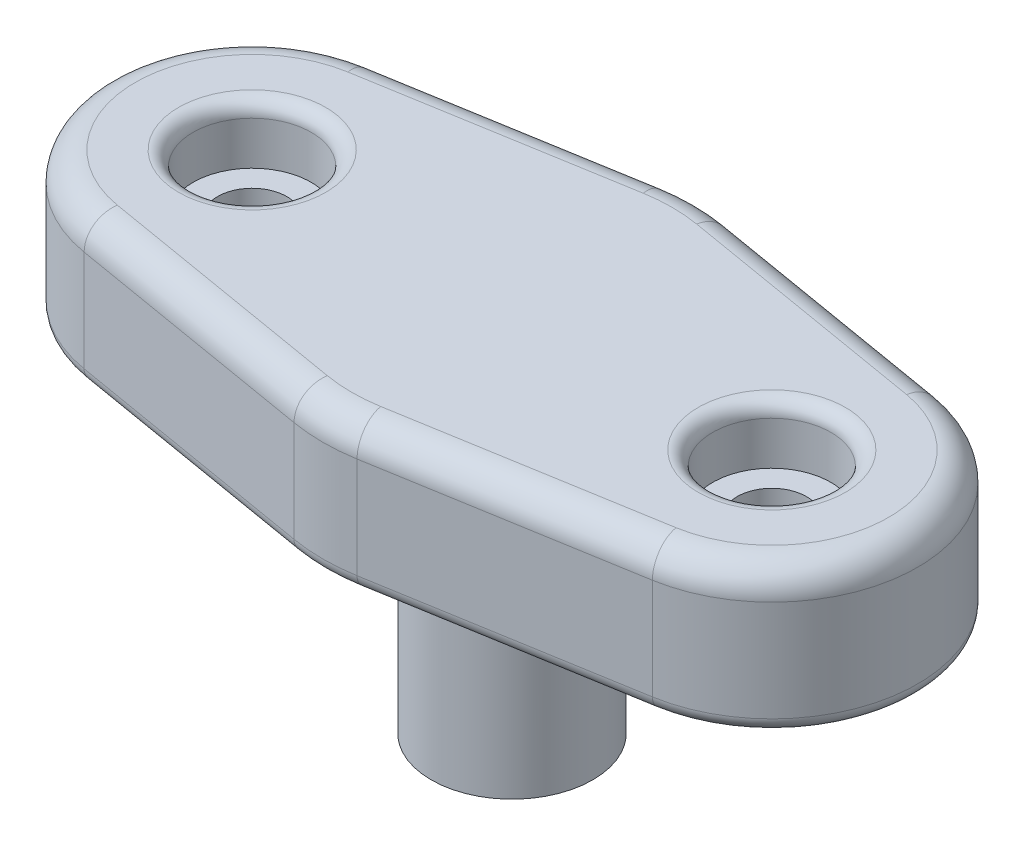
from build123d import *

# Parameters (mm, degrees)
SKETCH1_R           = 2.8
BOSS_EXTRUDE1_DEPTH = 8
SKETCH2_R           = 1.2
BOSS_EXTRUDE2_DEPTH = 5
SKETCH3_R           = 2.05
CUT_EXTRUDE1_DEPTH  = 2
FILLET1_R           = 0.5
FILLET2_R           = 1
SKETCH5_R           = 2
CUT_EXTRUDE2_DEPTH  = 2
FILLET3_R           = 1


with BuildPart() as part:
    # Sketch1 → Boss-Extrude1 (new body)
    with BuildSketch(Plane(origin=(0, 0, 0), x_dir=(1, 0, 0), z_dir=(0, 1, 0))):
        with Locations(Location((0, 0, 0), (0, 0, 270))):
            Circle(SKETCH1_R)
    extrude(amount=BOSS_EXTRUDE1_DEPTH)

    # Sketch2 → Boss-Extrude2 (add)
    with BuildSketch(Plane(origin=(0, 8, 0), x_dir=(1, 0, 0), z_dir=(0, 1, 0))):
        with BuildLine():
            Line((-9.841666667, 4.979367151), (-1.091666667, 6.458387097))
            ThreePointArc((-1.091666667, 6.458387097), (0, 6.55), (1.091666667, 6.458387097))
            Line((1.091666667, 6.458387097), (9.841666667, 4.979367151))
            ThreePointArc((9.841666667, 4.979367151), (14.05, 0), (9.841666667, -4.979367151))
            Line((9.841666667, -4.979367151), (1.091666667, -6.458387097))
            ThreePointArc((1.091666667, -6.458387097), (0, -6.55), (-1.091666667, -6.458387097))
            Line((-1.091666667, -6.458387097), (-9.841666667, -4.979367151))
            ThreePointArc((-9.841666667, -4.979367151), (-14.05, 0), (-9.841666667, 4.979367151))
        make_face()
        with Locations(Location((-9, 0, 0), (0, 0, 270))):
            Circle(SKETCH2_R, mode=Mode.SUBTRACT)
        with Locations(Location((9, 0, 0), (0, 0, 270))):
            Circle(SKETCH2_R, mode=Mode.SUBTRACT)
    extrude(amount=BOSS_EXTRUDE2_DEPTH)

    # Sketch3 → Cut-Extrude1 (cut)
    with BuildSketch(Plane(origin=(0, 13, 0), x_dir=(1, 0, 0), z_dir=(0, 1, 0))):
        with Locations(Location((-9, 0, 0), (0, 0, 270))):
            Circle(SKETCH3_R)
        with Locations(Location((9, 0, 0), (0, 0, 270))):
            Circle(SKETCH3_R)
    extrude(amount=-CUT_EXTRUDE1_DEPTH, mode=Mode.SUBTRACT)

    # Fillet1
    fillet1_edges = [part.edges().sort_by_distance(p)[0] for p in [
        (5.466666667, 8, 5.718877124),
        (14.05, 8, 0),
        (5.466666667, 8, -5.718877124),
        (0, 8, -6.55),
        (-5.466666667, 8, -5.718877124),
        (-9, 13, -2.05),
        (9, 13, -2.05),
        (-14.05, 8, 0),
        (-5.466666667, 8, 5.718877124),
        (0, 8, 6.55),
    ]]
    fillet(fillet1_edges, radius=FILLET1_R)

    # Fillet2
    fillet2_edges = [part.edges().sort_by_distance(p)[0] for p in [
        (-14.05, 13, 0),
        (-5.466666667, 13, 5.718877124),
        (0, 13, 6.55),
        (5.466666667, 13, 5.718877124),
        (14.05, 13, 0),
        (5.466666667, 13, -5.718877124),
        (0, 13, -6.55),
        (-5.466666667, 13, -5.718877124),
    ]]
    fillet(fillet2_edges, radius=FILLET2_R)

    # Sketch5 → Cut-Extrude2 (cut)
    with BuildSketch(Plane.XZ):
        with Locations(Location((0, 0, 0), (0, 0, 270))):
            Circle(SKETCH5_R)
    extrude(amount=-CUT_EXTRUDE2_DEPTH, mode=Mode.SUBTRACT)

    # Fillet3
    # the kernel refuses this fillet: 1 mm, written as the material it adds along each edge
    with BuildSketch(Plane(origin=(0, 2, 0), x_dir=(0, 0, -1), z_dir=(-1, 0, 0))) as fillet3_piece_1:
        with BuildLine():
            CenterArc((2 - FILLET3_R, FILLET3_R), FILLET3_R, 270, 90)
            Line((2 - FILLET3_R, 0), (2, 0))
            Line((2, 0), (2, FILLET3_R))
        make_face()
    revolve(axis=Axis((0, 2, 0), (0, -1, 0)))
    # the kernel refuses this fillet: 1 mm, written as the material it takes off along each edge
    with BuildSketch(Plane(origin=(0, 0, 0), x_dir=(0, 0, -1), z_dir=(-1, 0, 0))) as fillet3_2_piece_1:
        with BuildLine():
            CenterArc((3, -0.979795897), FILLET3_R, 101.536959033, 78.463040967)
            Line((2, -0.979795897), (2, 0))
            Line((2, 0), (2.8, 0))
        make_face()
    revolve(axis=Axis((0, 0, 0), (0, -1, 0)), mode=Mode.SUBTRACT)


solid = part.part
